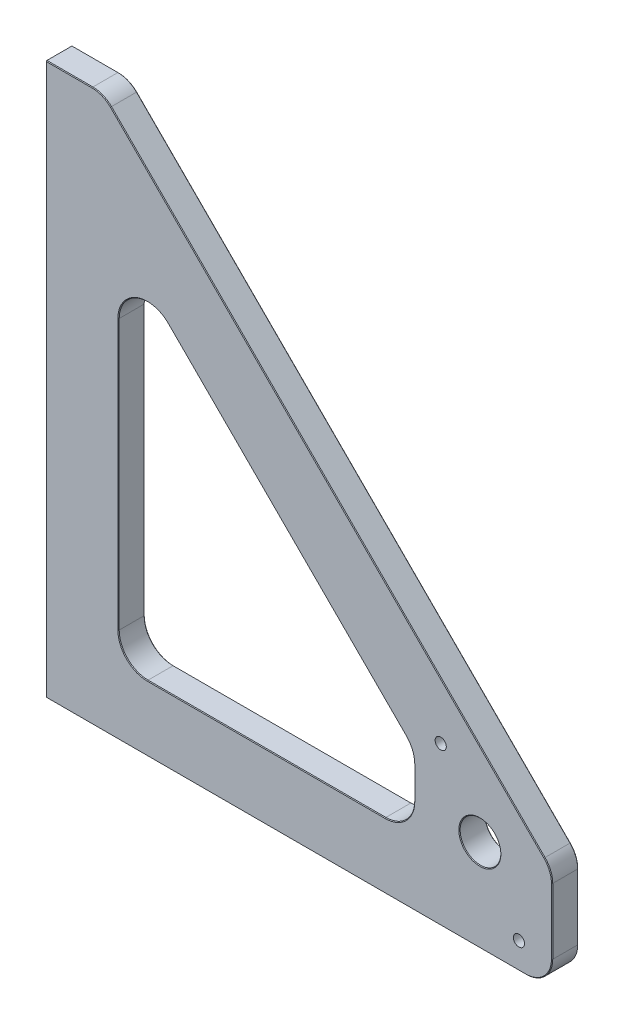
from build123d import *

# Parameters (mm, degrees)
AUFSATZ_LINEAR_AUSTRAGEN1_DEPTH      = 10
F_12_0_12_DURCHMESSER_BOHRUNG1_D     = 12
F_12_0_12_DURCHMESSER_BOHRUNG1_DEPTH = 30
F_12_0_12_DURCHMESSER_BOHRUNG1_TIP   = 3.605163714
M12_GEWINDEBOHRUNG1_D                = 10.2
M12_GEWINDEBOHRUNG1_DEPTH            = 32.75
M12_GEWINDEBOHRUNG1_TIP              = 3.064389157
SCHNITT_LINEAR_START                 = -10
SCHNITT_LINEAR_AUSTRAGEN1_OUTLINE_R  = 15.5
SCHNITT_LINEAR_AUSTRAGEN1_DEPTH      = 20
M10_START                            = -10
M10_GEWINDEBOHRUNG1_OUTLINE_R        = 4.25
M10_GEWINDEBOHRUNG1_DEPTH            = 20
M10_GEWINDEBOHRUNG2_D                = 8.5
M10_GEWINDEBOHRUNG2_DEPTH            = 27.5
M10_GEWINDEBOHRUNG2_TIP              = 2.553657631
FASE1_SIZE                           = 0.5


# Read off the part's stored shape, not the designer's step: Schnitt-Linear austragen1, M10 Gewindebohrung1
with BuildPart() as part:
    # Skizze1 → Aufsatz-Linear austragen1 (new, symmetric)
    with BuildSketch(Plane.XY):
        with BuildLine():
            Line((0, 0), (0, 420))
            Line((0, 420), (35, 420))
            ThreePointArc((35, 420), (42.653668647, 418.47759065), (49.142135624, 414.142135624))
            Line((49.142135624, 414.142135624), (379.142135624, 84.142135624))
            ThreePointArc((379.142135624, 84.142135624), (383.47759065, 77.653668647), (385, 70))
            Line((385, 70), (385, 20))
            ThreePointArc((385, 20), (379.142135624, 5.857864376), (365, 0))
            Line((365, 0), (0, 0))
        make_face()
    extrude(amount=AUFSATZ_LINEAR_AUSTRAGEN1_DEPTH, both=True)

    # Ø12.0 (12) Durchmesser Bohrung1
    with Locations(Plane.ZY):
        with Locations((0, 40), (0, 380)):
            Hole(F_12_0_12_DURCHMESSER_BOHRUNG1_D / 2, depth=F_12_0_12_DURCHMESSER_BOHRUNG1_DEPTH)
            with Locations((0, 0, -(F_12_0_12_DURCHMESSER_BOHRUNG1_DEPTH + F_12_0_12_DURCHMESSER_BOHRUNG1_TIP / 2))):  # 118° drill point
                Cone(0, F_12_0_12_DURCHMESSER_BOHRUNG1_D / 2, F_12_0_12_DURCHMESSER_BOHRUNG1_TIP, mode=Mode.SUBTRACT)

    # M12 Gewindebohrung1
    with Locations(Plane.ZY):
        with Locations((0, 20), (0, 210), (0, 400)):
            Hole(M12_GEWINDEBOHRUNG1_D / 2, depth=M12_GEWINDEBOHRUNG1_DEPTH)
            with Locations((0, 0, -(M12_GEWINDEBOHRUNG1_DEPTH + M12_GEWINDEBOHRUNG1_TIP / 2))):  # 118° drill point
                Cone(0, M12_GEWINDEBOHRUNG1_D / 2, M12_GEWINDEBOHRUNG1_TIP, mode=Mode.SUBTRACT)

    # Schnitt-Linear austragen1 outline → Schnitt-Linear austragen1 (cut)
    with BuildSketch(Plane.XY.offset(SCHNITT_LINEAR_START)):
        with BuildLine():
            Line((55, 277.389826945), (55, 72))
            ThreePointArc((55, 72), (61.443650814, 56.443650814), (77, 50))
            Line((77, 50), (258, 50))
            ThreePointArc((258, 50), (273.556349186, 56.443650814), (280, 72))
            Line((280, 72), (280, 96.389826945))
            ThreePointArc((280, 96.389826945), (278.325349715, 104.808862457), (273.556349186, 111.946176131))
            Line((273.556349186, 111.946176131), (92.556349186, 292.946176131))
            ThreePointArc((92.556349186, 292.946176131), (68.580964488, 297.71517666), (55, 277.389826945))
        make_face()
        with Locations((330, 70)):
            Circle(SCHNITT_LINEAR_AUSTRAGEN1_OUTLINE_R)
    extrude(amount=SCHNITT_LINEAR_AUSTRAGEN1_DEPTH, mode=Mode.SUBTRACT)

    # M10 Gewindebohrung1 outline → M10 Gewindebohrung1 (cut)
    with BuildSketch(Plane.XY.offset(M10_START)):
        with Locations((300.234254829, 120.07057933)):
            Circle(M10_GEWINDEBOHRUNG1_OUTLINE_R)
        with Locations((359.765745171, 19.92942067)):
            Circle(M10_GEWINDEBOHRUNG1_OUTLINE_R)
    extrude(amount=M10_GEWINDEBOHRUNG1_DEPTH, mode=Mode.SUBTRACT)

    # M10 Gewindebohrung2
    with Locations(Plane(origin=(0, 0, 0), x_dir=(-1, 0, 0), z_dir=(0, -1, 0))):
        with Locations((-324.5, 0), (-244.5, 0)):
            Hole(M10_GEWINDEBOHRUNG2_D / 2, depth=M10_GEWINDEBOHRUNG2_DEPTH)
            with Locations((0, 0, -(M10_GEWINDEBOHRUNG2_DEPTH + M10_GEWINDEBOHRUNG2_TIP / 2))):  # 118° drill point
                Cone(0, M10_GEWINDEBOHRUNG2_D / 2, M10_GEWINDEBOHRUNG2_TIP, mode=Mode.SUBTRACT)

    # Fase1
    fase1_edges = [part.edges().sort_by_distance(p)[0] for p in [
        (385, 45, 10),
        (379.142135624, 5.857864376, -10),
        (182.5, 0, -10),
        (383.47759065, 77.653668647, 10),
        (214.142135624, 249.142135624, 10),
        (42.653668647, 418.47759065, 10),
        (17.5, 420, 10),
        (182.5, 0, 10),
        (61.443650814, 56.443650814, -10),
        (55, 174.694913472, -10),
        (68.580964488, 297.71517666, -10),
        (183.056349186, 202.446176131, -10),
        (278.325349715, 104.808862457, -10),
        (280, 84.194913472, -10),
        (273.556349186, 56.443650814, -10),
        (167.5, 50, -10),
        (61.443650814, 56.443650814, 10),
        (167.5, 50, 10),
        (273.556349186, 56.443650814, 10),
        (280, 84.194913472, 10),
        (278.325349715, 104.808862457, 10),
        (183.056349186, 202.446176131, 10),
        (68.580964488, 297.71517666, 10),
        (55, 174.694913472, 10),
        (379.142135624, 5.857864376, 10),
        (314.5, 70, -10),
        (314.5, 70, 10),
        (17.5, 420, -10),
        (42.653668647, 418.47759065, -10),
        (214.142135624, 249.142135624, -10),
        (383.47759065, 77.653668647, -10),
        (385, 45, -10),
    ]]
    chamfer(fase1_edges, length=FASE1_SIZE)


solid = part.part
